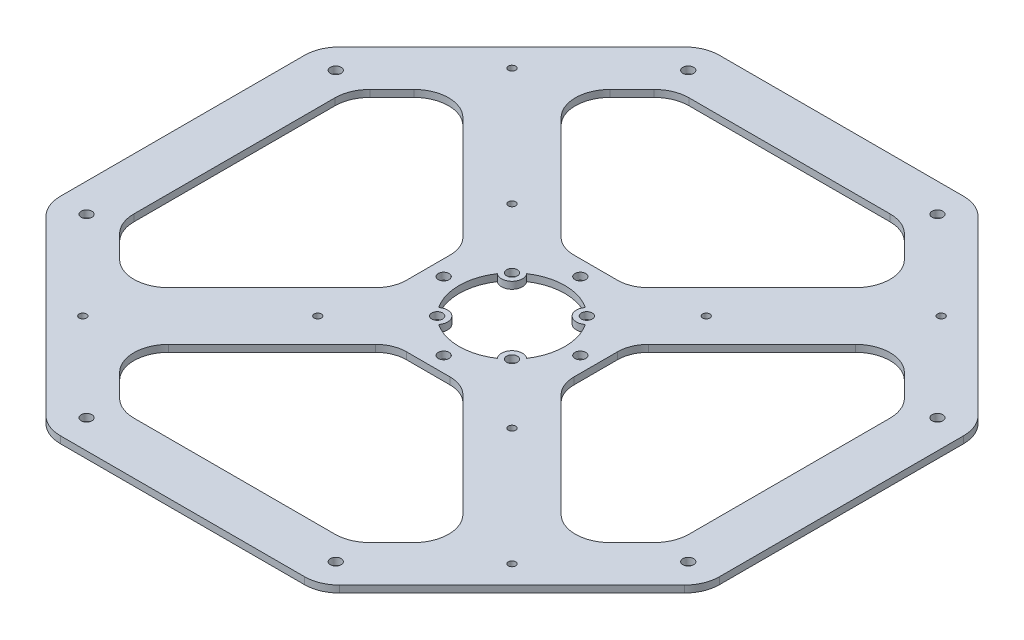
from build123d import *

# Parameters (mm, degrees)
SKETCH2_R           = 1.55
SKETCH2_R_2         = 1.05
BOSS_EXTRUDE1_DEPTH = 2


with BuildPart() as part:
    # Sketch2 → Boss-Extrude1 (new body)
    with BuildSketch(Plane(origin=(0, 0, 0), x_dir=(1, 0, 0), z_dir=(0, 1, 0))):
        with BuildLine():
            ThreePointArc((95, 35.208152802), (94.238795325, 39.034987125), (92.071067812, 42.279220614))
            Line((92.071067812, 42.279220614), (42.279220614, 92.071067812))
            ThreePointArc((42.279220614, 92.071067812), (39.034987125, 94.238795325), (35.208152802, 95))
            Line((35.208152802, 95), (-35.208152802, 95))
            ThreePointArc((-35.208152802, 95), (-39.034987125, 94.238795325), (-42.279220614, 92.071067812))
            Line((-42.279220614, 92.071067812), (-92.071067812, 42.279220614))
            ThreePointArc((-92.071067812, 42.279220614), (-94.238795325, 39.034987125), (-95, 35.208152802))
            Line((-95, 35.208152802), (-95, -35.208152802))
            ThreePointArc((-95, -35.208152802), (-94.238795325, -39.034987125), (-92.071067812, -42.279220614))
            Line((-92.071067812, -42.279220614), (-42.279220614, -92.071067812))
            ThreePointArc((-42.279220614, -92.071067812), (-39.034987125, -94.238795325), (-35.208152802, -95))
            Line((-35.208152802, -95), (35.208152802, -95))
            ThreePointArc((35.208152802, -95), (39.034987125, -94.238795325), (42.279220614, -92.071067812))
            Line((42.279220614, -92.071067812), (92.071067812, -42.279220614))
            ThreePointArc((92.071067812, -42.279220614), (94.238795325, -39.034987125), (95, -35.208152802))
            Line((95, -35.208152802), (95, 35.208152802))
        make_face()
        with Locations((10.783378413, 10.783378413)):
            Circle(SKETCH2_R, mode=Mode.SUBTRACT)
        with Locations((-61.871843354, -61.871843354)):
            Circle(SKETCH2_R_2, mode=Mode.SUBTRACT)
        with Locations((-35.928385408, -86.738795325)):
            Circle(SKETCH2_R, mode=Mode.SUBTRACT)
        with BuildLine():
            Line((-36.066017178, -77.071067812), (-42.426406871, -70.710678119))
            ThreePointArc((-42.426406871, -70.710678119), (-45.355339059, -63.639610307), (-42.426406871, -56.568542495))
            Line((-42.426406871, -56.568542495), (-12.63528481, -26.777420433))
            ThreePointArc((-12.63528481, -26.777420433), (-9.716310016, -24.827023831), (-6.273144482, -24.142135624))
            Line((-6.273144482, -24.142135624), (6.273144482, -24.142135624))
            ThreePointArc((6.273144482, -24.142135624), (9.716310016, -24.827023831), (12.63528481, -26.777420433))
            Line((12.63528481, -26.777420433), (42.426406871, -56.568542495))
            ThreePointArc((42.426406871, -56.568542495), (45.355339059, -63.639610307), (42.426406871, -70.710678119))
            Line((42.426406871, -70.710678119), (36.066017178, -77.071067812))
            ThreePointArc((36.066017178, -77.071067812), (32.82178369, -79.238795325), (28.994949366, -80))
            Line((28.994949366, -80), (-28.994949366, -80))
            ThreePointArc((-28.994949366, -80), (-32.82178369, -79.238795325), (-36.066017178, -77.071067812))
        make_face(mode=Mode.SUBTRACT)
        with Locations((-86.738795325, -35.928385408)):
            Circle(SKETCH2_R, mode=Mode.SUBTRACT)
        with Locations((-28, -28)):
            Circle(SKETCH2_R_2, mode=Mode.SUBTRACT)
        with Locations((0, -19.696067812)):
            Circle(SKETCH2_R, mode=Mode.SUBTRACT)
        with Locations((35.928385408, -86.738795325)):
            Circle(SKETCH2_R, mode=Mode.SUBTRACT)
        with Locations((61.871843354, -61.871843354)):
            Circle(SKETCH2_R_2, mode=Mode.SUBTRACT)
        with Locations((28, -28)):
            Circle(SKETCH2_R_2, mode=Mode.SUBTRACT)
        with Locations((19.696067812, 0)):
            Circle(SKETCH2_R, mode=Mode.SUBTRACT)
        with Locations((86.738795325, -35.928385408)):
            Circle(SKETCH2_R, mode=Mode.SUBTRACT)
        with BuildLine():
            Line((77.071067812, -36.066017178), (70.710678119, -42.426406871))
            ThreePointArc((70.710678119, -42.426406871), (63.639610307, -45.355339059), (56.568542495, -42.426406871))
            Line((56.568542495, -42.426406871), (26.777420433, -12.63528481))
            ThreePointArc((26.777420433, -12.63528481), (24.827023831, -9.716310016), (24.142135624, -6.273144482))
            Line((24.142135624, -6.273144482), (24.142135624, 6.273144482))
            ThreePointArc((24.142135624, 6.273144482), (24.827023831, 9.716310016), (26.777420433, 12.63528481))
            Line((26.777420433, 12.63528481), (56.568542495, 42.426406871))
            ThreePointArc((56.568542495, 42.426406871), (63.639610307, 45.355339059), (70.710678119, 42.426406871))
            Line((70.710678119, 42.426406871), (77.071067812, 36.066017178))
            ThreePointArc((77.071067812, 36.066017178), (79.238795325, 32.82178369), (80, 28.994949366))
            Line((80, 28.994949366), (80, -28.994949366))
            ThreePointArc((80, -28.994949366), (79.238795325, -32.82178369), (77.071067812, -36.066017178))
        make_face(mode=Mode.SUBTRACT)
        with BuildLine():
            Line((-77.071067812, 36.066017178), (-70.710678119, 42.426406871))
            ThreePointArc((-70.710678119, 42.426406871), (-63.639610307, 45.355339059), (-56.568542495, 42.426406871))
            Line((-56.568542495, 42.426406871), (-26.777420433, 12.63528481))
            ThreePointArc((-26.777420433, 12.63528481), (-24.827023831, 9.716310016), (-24.142135624, 6.273144482))
            Line((-24.142135624, 6.273144482), (-24.142135624, -6.273144482))
            ThreePointArc((-24.142135624, -6.273144482), (-24.827023831, -9.716310016), (-26.777420433, -12.63528481))
            Line((-26.777420433, -12.63528481), (-56.568542495, -42.426406871))
            ThreePointArc((-56.568542495, -42.426406871), (-63.639610307, -45.355339059), (-70.710678119, -42.426406871))
            Line((-70.710678119, -42.426406871), (-77.071067812, -36.066017178))
            ThreePointArc((-77.071067812, -36.066017178), (-79.238795325, -32.82178369), (-80, -28.994949366))
            Line((-80, -28.994949366), (-80, 28.994949366))
            ThreePointArc((-80, 28.994949366), (-79.238795325, 32.82178369), (-77.071067812, 36.066017178))
        make_face(mode=Mode.SUBTRACT)
        with Locations((-86.738795325, 35.928385408)):
            Circle(SKETCH2_R, mode=Mode.SUBTRACT)
        with Locations((-19.696067812, 0)):
            Circle(SKETCH2_R, mode=Mode.SUBTRACT)
        with Locations((-28, 28)):
            Circle(SKETCH2_R_2, mode=Mode.SUBTRACT)
        with Locations((-61.871843354, 61.871843354)):
            Circle(SKETCH2_R_2, mode=Mode.SUBTRACT)
        with Locations((-35.928385408, 86.738795325)):
            Circle(SKETCH2_R, mode=Mode.SUBTRACT)
        with BuildLine():
            ThreePointArc((-8.463690245, 12.685757661), (-4.421803686, 14.594867323), (0, 15.25))
            ThreePointArc((0, 15.25), (4.421803686, 14.594867323), (8.463690245, 12.685757661))
            ThreePointArc((8.463690245, 12.685757661), (8.66205807, 8.66205807), (12.685757661, 8.463690245))
            ThreePointArc((12.685757661, 8.463690245), (15.25, 0), (12.685757661, -8.463690245))
            ThreePointArc((12.685757661, -8.463690245), (8.66205807, -8.66205807), (8.463690245, -12.685757661))
            ThreePointArc((8.463690245, -12.685757661), (0, -15.25), (-8.463690245, -12.685757661))
            ThreePointArc((-8.463690245, -12.685757661), (-8.66205807, -8.66205807), (-12.685757661, -8.463690245))
            ThreePointArc((-12.685757661, -8.463690245), (-15.25, 0), (-12.685757661, 8.463690245))
            ThreePointArc((-12.685757661, 8.463690245), (-8.66205807, 8.66205807), (-8.463690245, 12.685757661))
        make_face(mode=Mode.SUBTRACT)
        with BuildLine():
            ThreePointArc((0, 18.146067812), (-1.55, 19.696067812), (0, 21.246067812))
            ThreePointArc((0, 21.246067812), (1.55, 19.696067812), (0, 18.146067812))
        make_face(mode=Mode.SUBTRACT)
        with Locations((28, 28)):
            Circle(SKETCH2_R_2, mode=Mode.SUBTRACT)
        with Locations((86.738795325, 35.928385408)):
            Circle(SKETCH2_R, mode=Mode.SUBTRACT)
        with BuildLine():
            Line((36.066017178, 77.071067812), (42.426406871, 70.710678119))
            ThreePointArc((42.426406871, 70.710678119), (45.355339059, 63.639610307), (42.426406871, 56.568542495))
            Line((42.426406871, 56.568542495), (12.63528481, 26.777420433))
            ThreePointArc((12.63528481, 26.777420433), (9.716310016, 24.827023831), (6.273144482, 24.142135624))
            Line((6.273144482, 24.142135624), (0, 24.142135624))
            Line((0, 24.142135624), (-6.273144482, 24.142135624))
            ThreePointArc((-6.273144482, 24.142135624), (-9.716310016, 24.827023831), (-12.63528481, 26.777420433))
            Line((-12.63528481, 26.777420433), (-42.426406871, 56.568542495))
            ThreePointArc((-42.426406871, 56.568542495), (-45.355339059, 63.639610307), (-42.426406871, 70.710678119))
            Line((-42.426406871, 70.710678119), (-36.066017178, 77.071067812))
            ThreePointArc((-36.066017178, 77.071067812), (-32.82178369, 79.238795325), (-28.994949366, 80))
            Line((-28.994949366, 80), (28.994949366, 80))
            ThreePointArc((28.994949366, 80), (32.82178369, 79.238795325), (36.066017178, 77.071067812))
        make_face(mode=Mode.SUBTRACT)
        with Locations((35.928385408, 86.738795325)):
            Circle(SKETCH2_R, mode=Mode.SUBTRACT)
        with Locations((61.871843354, 61.871843354)):
            Circle(SKETCH2_R_2, mode=Mode.SUBTRACT)
        with Locations((-10.783378413, 10.783378413)):
            Circle(SKETCH2_R, mode=Mode.SUBTRACT)
        with Locations((-10.783378413, -10.783378413)):
            Circle(SKETCH2_R, mode=Mode.SUBTRACT)
        with Locations((10.783378413, -10.783378413)):
            Circle(SKETCH2_R, mode=Mode.SUBTRACT)
    extrude(amount=BOSS_EXTRUDE1_DEPTH)


solid = part.part
